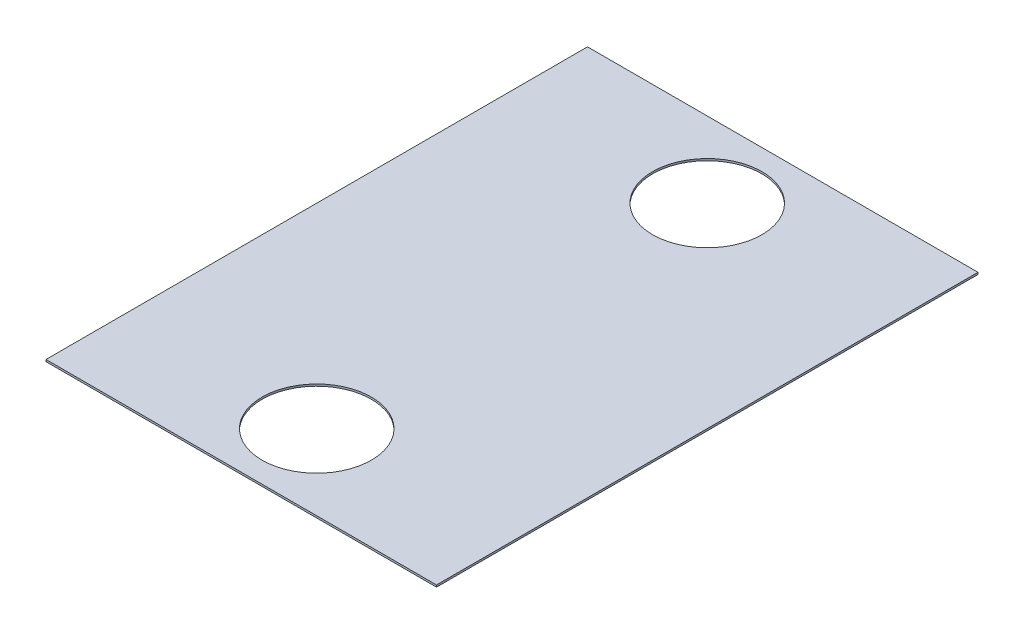
from build123d import *

# Parameters (mm, degrees)
SK_PAN_W        = 300
SK_PAN_H        = 416
SM_PAN_DEPTH    = 1.5
SK_HOLES_R      = 42
CUT_HOLES_DEPTH = 1.5


# Sheet-metal steps are written as plain solids
with BuildPart() as part:
    # SK_Pan → SM_Pan (new body)
    with BuildSketch(Plane(origin=(0, 0, 0), x_dir=(1, 0, 0), z_dir=(0, 1, 0))):
        Rectangle(SK_PAN_W, SK_PAN_H)
    extrude(amount=SM_PAN_DEPTH)

    # SK_Holes → CUT_Holes (cut)
    with BuildSketch(Plane(origin=(0, 0, 0), x_dir=(1, 0, 0), z_dir=(0, 1, 0))):
        with Locations(Location((0, -150, 0), (0, 0, 270))):
            Circle(SK_HOLES_R)
        with Locations(Location((0, 150, 0), (0, 0, 270))):
            Circle(SK_HOLES_R)
    extrude(amount=CUT_HOLES_DEPTH, mode=Mode.SUBTRACT)


solid = part.part
